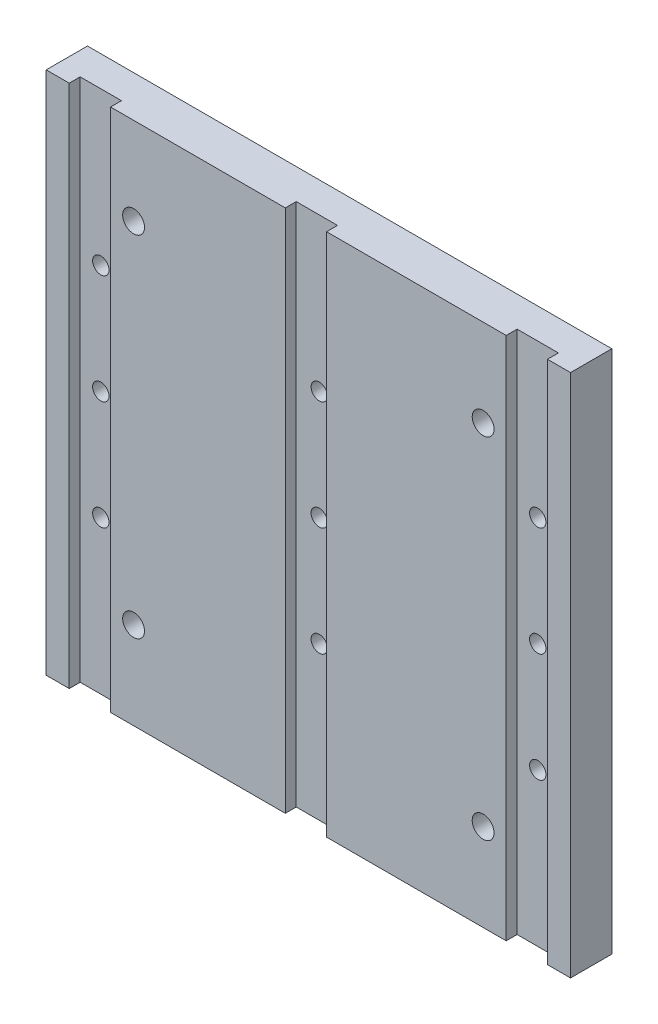
from build123d import *

# Parameters (mm, degrees)
SKETCH1_W           = 152.4
SKETCH1_H           = 152.4
SKETCH1_R           = 3.175
BOSS_EXTRUDE1_DEPTH = 12.0000014
SKETCH2_W           = 12.0000014
SKETCH2_H           = 152.4
CUT_EXTRUDE1_DEPTH  = 3.175
SKETCH3_R           = 2.38125
CUT_EXTRUDE2_DEPTH  = 109.123820917
SKETCH4_R           = 3.96875
CUT_EXTRUDE3_DEPTH  = 2.54
LPATTERN1_COUNT     = 3
LPATTERN1_PITCH     = 63.5


with BuildPart() as part:
    # Sketch1 → Boss-Extrude1 (new body)
    with BuildSketch(Plane.XY):
        Rectangle(SKETCH1_W, SKETCH1_H)
        with Locations((-50.8, 50.8)):
            Circle(SKETCH1_R, mode=Mode.SUBTRACT)
        with Locations((50.8, 50.8)):
            Circle(SKETCH1_R, mode=Mode.SUBTRACT)
        with Locations((50.8, -50.8)):
            Circle(SKETCH1_R, mode=Mode.SUBTRACT)
        with Locations((-50.8, -50.8)):
            Circle(SKETCH1_R, mode=Mode.SUBTRACT)
    extrude(amount=BOSS_EXTRUDE1_DEPTH)

    # Sketch2 → Cut-Extrude1 (cut)
    with BuildSketch(Plane.XY.offset(12.0000014)):
        with Locations((-63.5, 0)):
            Rectangle(SKETCH2_W, SKETCH2_H)
        with Locations((-0.6999986, 0)):
            Rectangle(SKETCH2_W, SKETCH2_H)
        with Locations((63.5, 0)):
            Rectangle(SKETCH2_W, SKETCH2_H)
    extrude(amount=-CUT_EXTRUDE1_DEPTH, mode=Mode.SUBTRACT)

    # Sketch3 → Cut-Extrude2 (cut, through all)
    with BuildSketch(Plane.XY.offset(8.8250014)):
        with Locations((-63.5, 0)):
            Circle(SKETCH3_R)
        with Locations((-63.5, 31.75)):
            Circle(SKETCH3_R)
        with Locations((-63.5, -31.75)):
            Circle(SKETCH3_R)
    cut_extrude2 = extrude(amount=-CUT_EXTRUDE2_DEPTH, mode=Mode.SUBTRACT)

    # Sketch4 → Cut-Extrude3 (cut)
    with BuildSketch(Plane(origin=(0, 0, 0), x_dir=(-1, 0, 0), z_dir=(0, 0, -1))):
        with Locations((63.5, 31.75)):
            Circle(SKETCH4_R)
        with Locations((63.5, 0)):
            Circle(SKETCH4_R)
        with Locations((63.5, -31.75)):
            Circle(SKETCH4_R)
    cut_extrude3 = extrude(amount=-CUT_EXTRUDE3_DEPTH, mode=Mode.SUBTRACT)

    # LPattern1: Cut-Extrude2, Cut-Extrude3 ×3
    with Locations(*[(i * LPATTERN1_PITCH, 0, 0) for i in range(1, LPATTERN1_COUNT)]):
        add(cut_extrude2, mode=Mode.SUBTRACT)
        add(cut_extrude3, mode=Mode.SUBTRACT)


solid = part.part
